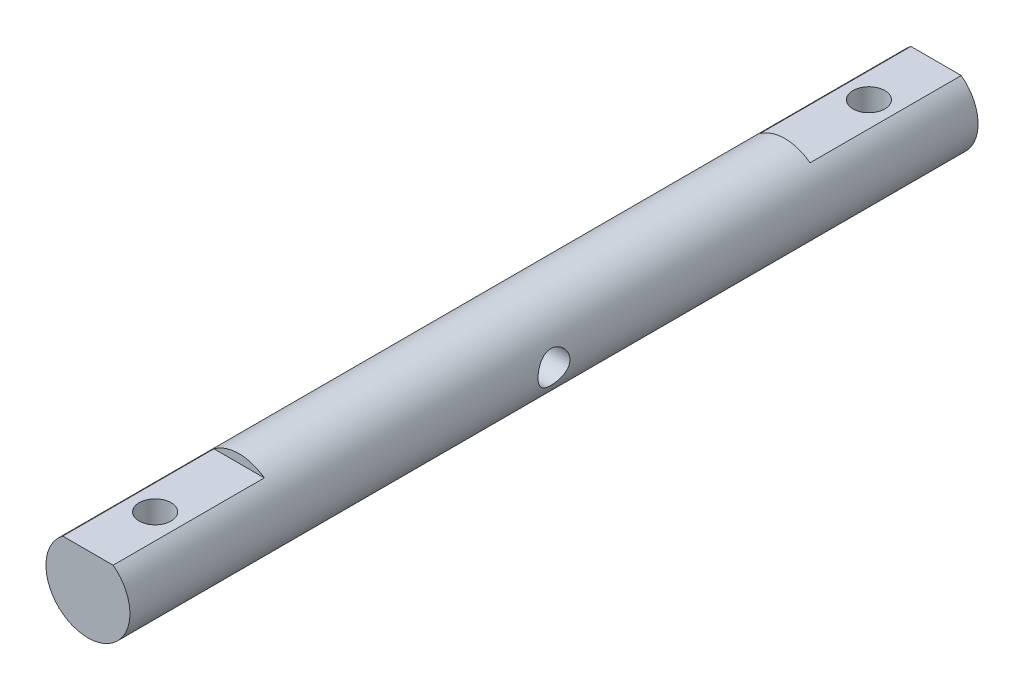
from build123d import *

# Parameters (mm, degrees)
SKETCH_1_R           = 5
EXTRUDE_1_DEPTH      = 50.5
SKETCH_2_R           = 1.9
CUT_EXTRUDE_1_DEPTH  = 35
SKETCH_4_W           = 19.302269546
SKETCH_4_H           = 20
SKETCH_4_W_2         = 39.729743848
CUT_EXTRUDE_2_DEPTH  = 36
EXTRUDE_2_REACH      = 52.993
EXTRUDE_2_END_RADIUS = 5
SKETCH_5_R           = 1.9
EXTRUDE_3_REACH      = 52.993
EXTRUDE_3_END_RADIUS = 5
SKETCH_6_R           = 1.9
SKETCH_7_R           = 1.9
CUT_EXTRUDE_3_DEPTH  = 18


with BuildPart() as part:
    # 草图1 → 凸台-拉伸1 (new, symmetric)
    with BuildSketch(Plane.XY):
        Circle(SKETCH_1_R)
    extrude(amount=EXTRUDE_1_DEPTH, both=True)

    # 草图2 → 切除-拉伸1 (cut, symmetric)
    with BuildSketch(Plane(origin=(0, 0, 0), x_dir=(1, 0, 0), z_dir=(0, 1, 0))):
        Circle(SKETCH_2_R)
        with Locations((0, 42.5)):
            Circle(SKETCH_2_R)
        with Locations((0, -42.5)):
            Circle(SKETCH_2_R)
    extrude(amount=CUT_EXTRUDE_1_DEPTH, both=True, mode=Mode.SUBTRACT)

    # 草图4 → 切除-拉伸2 (cut)
    with BuildSketch(Plane(origin=(0, 4, 0), x_dir=(1, 0, 0), z_dir=(0, 1, 0))):
        with Locations((0, 42.5)):
            Rectangle(SKETCH_4_W, SKETCH_4_H)
        with Locations((0, -42.5)):
            Rectangle(SKETCH_4_W_2, SKETCH_4_H)
    extrude(amount=CUT_EXTRUDE_2_DEPTH, mode=Mode.SUBTRACT)

    # 凸台-拉伸2: up to this cylinder (the profile starts inside it)
    extrude_2_end = Plane(origin=(0, 0, 0), z_dir=(0, 0, -1)) * Cylinder(EXTRUDE_2_END_RADIUS, 116.986, mode=Mode.PRIVATE)
    # 草图5 → 凸台-拉伸2 (add, up to the surface)
    with BuildSketch(Plane(origin=(0, 0, 0), x_dir=(1, 0, 0), z_dir=(0, 1, 0)), mode=Mode.PRIVATE) as extrude_2_sk1:
        Circle(SKETCH_5_R)
    extrude_2_tool1 = extrude(extrude_2_sk1.sketch, amount=EXTRUDE_2_REACH, mode=Mode.PRIVATE) & extrude_2_end
    add(extrude_2_tool1.solids().sort_by_distance((0, 0, 0))[0])

    # 凸台-拉伸3: up to this cylinder (the profile starts inside it)
    extrude_3_end = Plane(origin=(0, 0, 0), z_dir=(0, 0, -1)) * Cylinder(EXTRUDE_3_END_RADIUS, 116.986, mode=Mode.PRIVATE)
    # 草图6 → 凸台-拉伸3 (add, up to the surface)
    with BuildSketch(Plane.XZ, mode=Mode.PRIVATE) as extrude_3_sk1:
        Circle(SKETCH_6_R)
    extrude_3_tool1 = extrude(extrude_3_sk1.sketch, amount=EXTRUDE_3_REACH, mode=Mode.PRIVATE) & extrude_3_end
    add(extrude_3_tool1.solids().sort_by_distance((0, 0, 0))[0])

    # 草图7 → 切除-拉伸3 (cut, symmetric)
    with BuildSketch(Plane(origin=(0, 0, 0), x_dir=(0, 0, -1), z_dir=(1, 0, 0))):
        Circle(SKETCH_7_R)
    extrude(amount=CUT_EXTRUDE_3_DEPTH, both=True, mode=Mode.SUBTRACT)


solid = part.part
